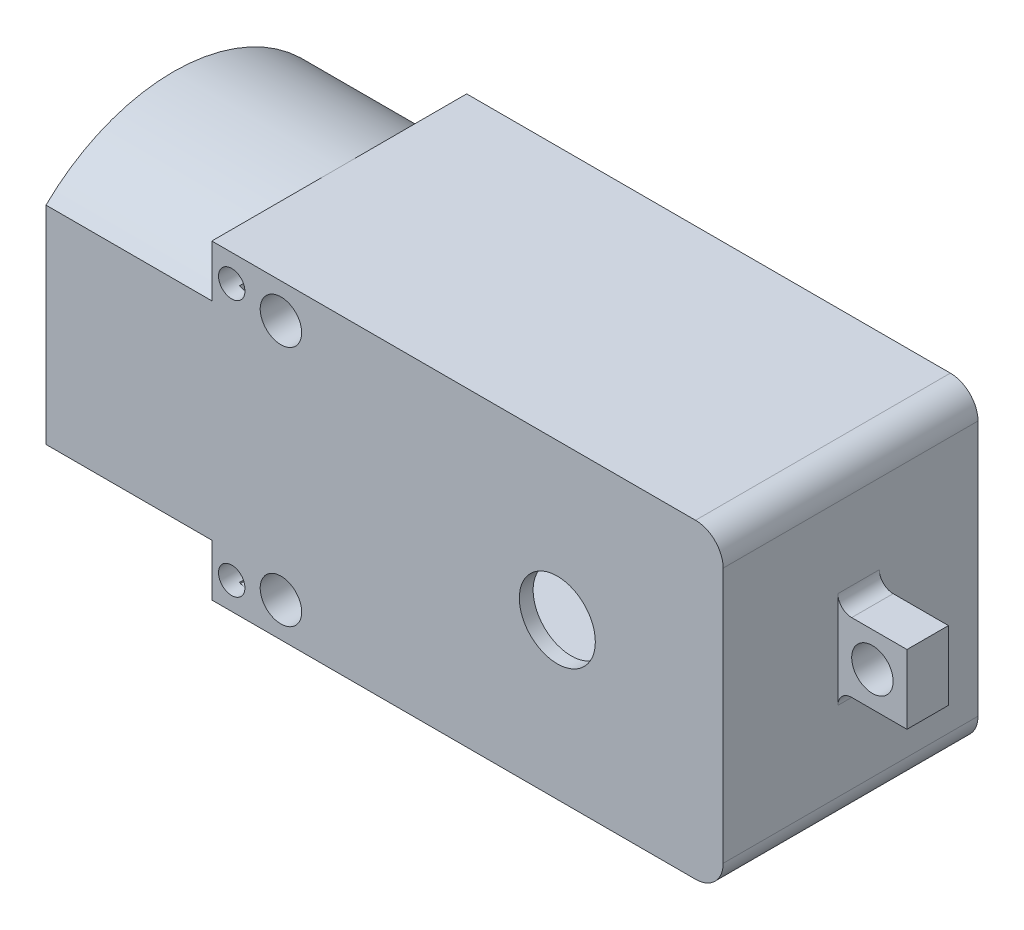
from build123d import *

# Parameters (mm, degrees)
SKETCH1_R                = 1.5
BOSS_EXTRUDE1_DEPTH      = 9.22
BOSS_EXTRUDE2_DEPTH      = 12
SHELL1_START             = -10
SHELL1_OUTLINE_W         = 20.5
SHELL1_OUTLINE_H         = 16.44
SHELL1_DEPTH             = 27.5
SHELL1_START_2           = -29.5
SHELL1_2_DEPTH           = 14.5
SHELL1_START_3           = -16.5
SHELL1_3_DEPTH           = 1.5
SHELL1_START_4           = -8.22
SHELL1_4_DEPTH           = 16.44
SKETCH3_R                = 1.5
BOSS_EXTRUDE3_DEPTH      = 1
BOSS_EXTRUDE4_DEPTH      = 1.5
BOSS_EXTRUDE4_DEPTH_BACK = 1.5
SKETCH6_W                = 5
SKETCH6_H                = 5
SKETCH6_R                = 1.5
SKETCH7_R                = 2.75
CUT_EXTRUDE1_DEPTH       = 37.562906066
FILLET1_R                = 1
CUT_EXTRUDE2_DEPTH       = 20
CUT_EXTRUDE2_DEPTH_BACK  = 20
SKETCH8_R                = 0.956029162


with BuildPart() as part:
    # Sketch1 → Boss-Extrude1 (new, symmetric)
    with BuildSketch(Plane.XY):
        with BuildLine():
            Line((17.5, -11.25), (-17.5, -11.25))
            Line((-17.5, -11.25), (-17.5, 11.25))
            Line((-17.5, 11.25), (17.5, 11.25))
            ThreePointArc((17.5, 11.25), (18.914213562, 10.664213562), (19.5, 9.25))
            Line((19.5, 9.25), (19.5, -9.25))
            ThreePointArc((19.5, -9.25), (18.914213562, -10.664213562), (17.5, -11.25))
        make_face()
        with Locations((-12.5, 8.75)):
            Circle(SKETCH1_R, mode=Mode.SUBTRACT)
        with Locations((-12.5, -8.75)):
            Circle(SKETCH1_R, mode=Mode.SUBTRACT)
    extrude(amount=BOSS_EXTRUDE1_DEPTH, both=True)

    # Sketch2 → Boss-Extrude2 (add)
    with BuildSketch(Plane.ZY.offset(17.5)):
        with BuildLine():
            Line((9.22, -7.5), (9.22, 7.5))
            ThreePointArc((9.22, 7.5), (0, 11.25), (-9.22, 7.5))
            Line((-9.22, 7.5), (-9.22, -7.5))
            ThreePointArc((-9.22, -7.5), (0, -11.25), (9.22, -7.5))
        make_face()
    extrude(amount=BOSS_EXTRUDE2_DEPTH)

    # Shell1: read off the stored shape, not the designer's step
    # Shell1 outline → Shell1 (cut)
    with BuildSketch(Plane.YZ.offset(SHELL1_START)):
        Rectangle(SHELL1_OUTLINE_W, SHELL1_OUTLINE_H)
    extrude(amount=SHELL1_DEPTH, mode=Mode.SUBTRACT)

    # Shell1 2 outline → Shell1 2 (cut)
    with BuildSketch(Plane.YZ.offset(SHELL1_START_2)):
        with BuildLine():
            ThreePointArc((7.068411902, -8.22), (10.25, 0), (7.068411902, 8.22))
            Line((7.068411902, 8.22), (-7.068411902, 8.22))
            ThreePointArc((-7.068411902, 8.22), (-10.25, 0), (-7.068411902, -8.22))
            Line((-7.068411902, -8.22), (7.068411902, -8.22))
        make_face()
    extrude(amount=SHELL1_2_DEPTH, mode=Mode.SUBTRACT)

    # Shell1 3 outline → Shell1 3 (cut)
    with BuildSketch(Plane.YZ.offset(SHELL1_START_3)):
        with BuildLine():
            Line((10.25, 0), (10.25, 8.22))
            Line((10.25, 8.22), (7.068411902, 8.22))
            ThreePointArc((7.068411902, 8.22), (9.426855331, 4.407122157), (10.25, 0))
        make_face()
        with BuildLine():
            Line((10.25, -8.22), (10.25, 0))
            ThreePointArc((10.25, 0), (9.426855331, -4.407122157), (7.068411902, -8.22))
            Line((7.068411902, -8.22), (10.25, -8.22))
        make_face()
        with BuildLine():
            ThreePointArc((-10.25, 0), (-9.426855331, 4.407122157), (-7.068411902, 8.22))
            Line((-7.068411902, 8.22), (-10.25, 8.22))
            Line((-10.25, 8.22), (-10.25, 0))
        make_face()
        with BuildLine():
            Line((-10.25, -8.22), (-7.068411902, -8.22))
            ThreePointArc((-7.068411902, -8.22), (-9.426855331, -4.407122157), (-10.25, 0))
            Line((-10.25, 0), (-10.25, -8.22))
        make_face()
    extrude(amount=SHELL1_3_DEPTH, mode=Mode.SUBTRACT)

    # Shell1 4 outline → Shell1 4 (cut)
    with BuildSketch(Plane.XY.offset(SHELL1_START_4)):
        with BuildLine():
            ThreePointArc((-14.5, -10.25), (-14.871708245, -9.540569415), (-15, -8.75))
            Line((-15, -8.75), (-15, -10.25))
            Line((-15, -10.25), (-14.5, -10.25))
        make_face()
        with BuildLine():
            ThreePointArc((-10, 8.75), (-12.499999993, 6.25), (-15, 8.749999987))
            Line((-15, 8.749999987), (-15, -8.75))
            ThreePointArc((-15, -8.75), (-12.5, -6.25), (-10, -8.75))
            Line((-10, -8.75), (-10, 8.75))
        make_face()
        with BuildLine():
            Line((-14.5, 10.25), (-15, 10.25))
            Line((-15, 10.25), (-15, 8.749999987))
            ThreePointArc((-15, 8.749999987), (-14.871708247, 9.540569409), (-14.5, 10.25))
        make_face()
        with BuildLine():
            ThreePointArc((-10.5, 10.25), (-10.128291755, 9.540569415), (-10, 8.75))
            Line((-10, 8.75), (-10, 10.25))
            Line((-10, 10.25), (-10.5, 10.25))
        make_face()
        with BuildLine():
            Line((-10, -10.25), (-10, -8.75))
            ThreePointArc((-10, -8.75), (-10.128291755, -9.540569415), (-10.5, -10.25))
            Line((-10.5, -10.25), (-10, -10.25))
        make_face()
        with BuildLine():
            ThreePointArc((18.5, 9.25), (18.207106781, 9.957106781), (17.5, 10.25))
            Line((17.5, 10.25), (17.5, -10.25))
            ThreePointArc((17.5, -10.25), (18.207106781, -9.957106781), (18.5, -9.25))
            Line((18.5, -9.25), (18.5, 9.25))
        make_face()
    extrude(amount=SHELL1_4_DEPTH, mode=Mode.SUBTRACT)

    # Sketch3 → Boss-Extrude3 (add)
    with BuildSketch(Plane.ZY.offset(17.5)):
        with BuildLine():
            Line((-9.22, 7.5), (-9.22, -7.5))
            ThreePointArc((-9.22, -7.5), (0, -11.25), (9.22, -7.5))
            Line((9.22, -7.5), (9.22, 7.5))
            ThreePointArc((9.22, 7.5), (0, 11.25), (-9.22, 7.5))
        make_face()
        Circle(SKETCH3_R, mode=Mode.SUBTRACT)
    extrude(amount=BOSS_EXTRUDE3_DEPTH)

    # Sketch6 → Boss-Extrude4 (add, two sides: drawn at the far end of the back side and taken through both)
    with BuildSketch(Plane.XY.offset(-0.58).offset(-BOSS_EXTRUDE4_DEPTH_BACK)):
        with Locations((22, 0)):
            Rectangle(SKETCH6_W, SKETCH6_H)
        with Locations((22, 0)):
            Circle(SKETCH6_R, mode=Mode.SUBTRACT)
    extrude(amount=BOSS_EXTRUDE4_DEPTH + BOSS_EXTRUDE4_DEPTH_BACK)

    # Sketch7 → Cut-Extrude1 (cut, through all)
    with BuildSketch(Plane.XY.offset(9.22)):
        with Locations((7.5, 0)):
            Circle(SKETCH7_R)
    extrude(amount=-CUT_EXTRUDE1_DEPTH, mode=Mode.SUBTRACT)

    # Fillet1
    fillet1_edges = [part.edges().sort_by_distance(p)[0] for p in [
        (19.5, 2.5, -0.58),
        (19.5, -2.5, -0.58),
    ]]
    fillet(fillet1_edges, radius=FILLET1_R)

    # Sketch8 → Cut-Extrude2 (cut, two sides: drawn at the far end of the back side and taken through both)
    with BuildSketch(Plane.XY.offset(-0.58).offset(-CUT_EXTRUDE2_DEPTH_BACK)):
        with Locations(Location((-16.061963922, 9.293970838, 0), (0, 0, 242.73008166))):
            Circle(SKETCH8_R)
        with Locations(Location((-16.061963922, -9.293970838, 0), (0, 0, 242.730056197))):
            Circle(SKETCH8_R)
    extrude(amount=CUT_EXTRUDE2_DEPTH + CUT_EXTRUDE2_DEPTH_BACK, mode=Mode.SUBTRACT)


solid = part.part
